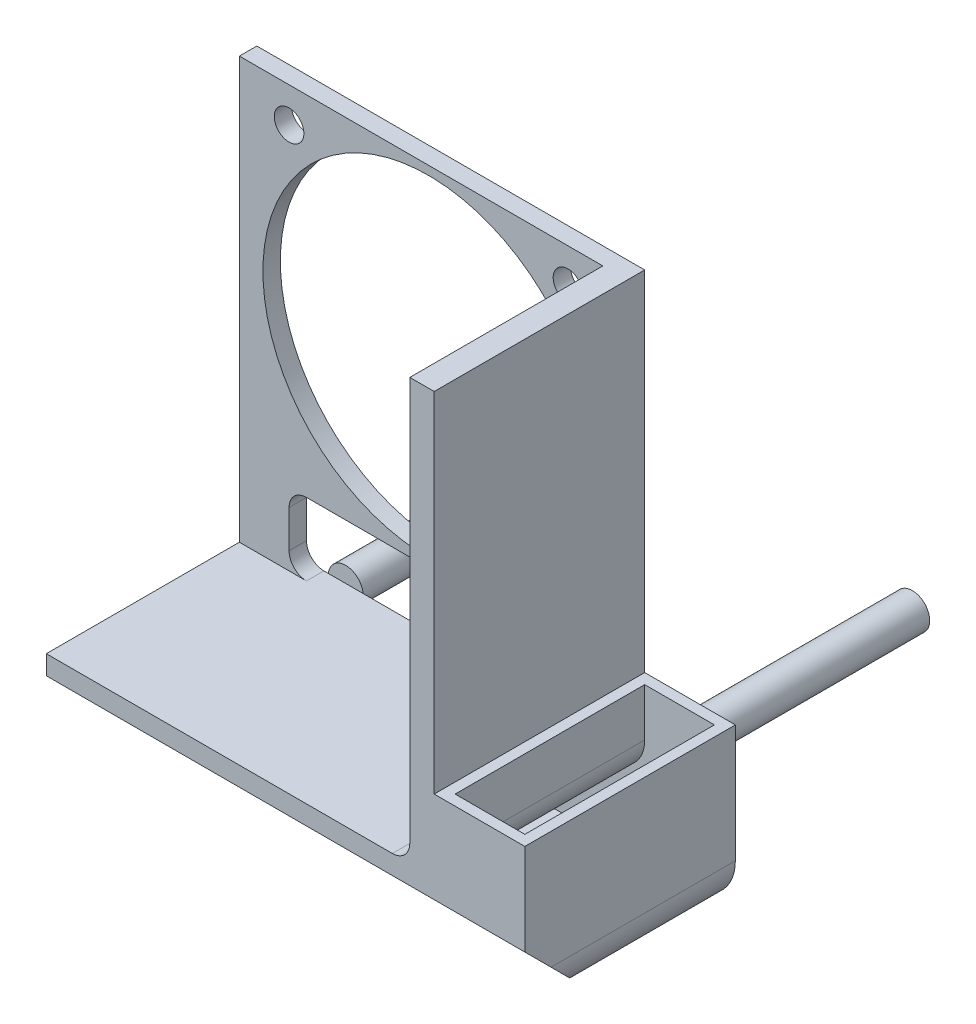
from build123d import *

# Parameters (mm, degrees)
SKETCH1_W              = 40
SKETCH1_H              = 40
BOSS_EXTRUDE1_DEPTH    = 2
M3_CLEARANCE_HOLE1_D   = 3.4
SKETCH10_W             = 40
SKETCH10_H             = 8.3
BOSS_EXTRUDE7_DEPTH    = 2
BOSS_EXTRUDE10_START   = 6
SKETCH20_R             = 2
BOSS_EXTRUDE10_DEPTH   = 30
BOSS_EXTRUDE10_2_DEPTH = 30
BOSS_EXTRUDE11_DEPTH   = 21.75
CHAMFER1_SIZE          = 7.5
FILLET1_R              = 4
SHELL1_T               = 1.2
SKETCH25_W             = 2.8
SKETCH25_H             = 48.3
BOSS_EXTRUDE14_DEPTH   = 24.15
SKETCH26_W             = 36
SKETCH26_H             = 8.3
CUT_EXTRUDE5_DEPTH     = 77.64359073
SKETCH27_R             = 19
CUT_EXTRUDE6_DEPTH     = 77.64359073
FILLET2_R              = 2
FILLET3_R              = 2
SKETCH29_W             = 1.7
SKETCH29_H             = 48.3
BOSS_EXTRUDE15_DEPTH   = 2
DELETEFACE1_OUTLINE_R  = 1.7
DELETEFACE1_DEPTH      = 2


# Read off the part's stored shape, not the designer's step: DeleteFace1
with BuildPart() as part:
    # Sketch1 → Boss-Extrude1 (new body)
    with BuildSketch(Plane.XY):
        with Locations((20, 20)):
            Rectangle(SKETCH1_W, SKETCH1_H)
    extrude(amount=BOSS_EXTRUDE1_DEPTH)

    # M3 Clearance Hole1 (through all)
    with Locations(Plane.XY.offset(2)):
        with Locations((4, 36), (36, 4), (4, 4), (36, 36)):
            Hole(M3_CLEARANCE_HOLE1_D / 2)

    # Sketch10 → Boss-Extrude7 (add)
    with BuildSketch(Plane.XY.offset(2)):
        with Locations((20, -4.15)):
            Rectangle(SKETCH10_W, SKETCH10_H)
    extrude(amount=-BOSS_EXTRUDE7_DEPTH)



with BuildPart() as body_2:
    # Sketch20 → Boss-Extrude10 (new body)
    with BuildSketch(Plane(origin=(0, 0, 0), x_dir=(-1, 0, 0), z_dir=(0, 0, -1)).offset(BOSS_EXTRUDE10_START)):
        with Locations((-37.5, -14.5)):
            Circle(SKETCH20_R)
    extrude(amount=BOSS_EXTRUDE10_DEPTH)


with BuildPart() as body_3:
    # Sketch20 → Boss-Extrude10 2 (new body)
    with BuildSketch(Plane(origin=(0, 0, 0), x_dir=(-1, 0, 0), z_dir=(0, 0, -1)).offset(BOSS_EXTRUDE10_START)):
        with Locations((-2.5, -14.5)):
            Circle(SKETCH20_R)
    extrude(amount=BOSS_EXTRUDE10_2_DEPTH)


with BuildPart() as body_4:
    # Sketch22 → Boss-Extrude11 (new body)
    with BuildSketch(Plane(origin=(0, 0, 22.95), x_dir=(-1, 0, 0), z_dir=(0, 0, -1))):
        Polygon((-44, 0), (-52, 0), (-52, -17.5), (0.5, -17.5), (0.5, -9.5), (-44, -9.5), align=None)
    extrude(amount=BOSS_EXTRUDE11_DEPTH)

    # Chamfer1
    chamfer1_edges = [body_4.edges().sort_by_distance(p)[0] for p in [
        (25.75, -17.5, 22.95),
    ]]
    chamfer(chamfer1_edges, length=CHAMFER1_SIZE)

    # Fillet1
    fillet1_edges = [body_4.edges().sort_by_distance(p)[0] for p in [
        (44, -9.5, 12.075),
        (52, -17.5, 8.325),
    ]]
    fillet(fillet1_edges, radius=FILLET1_R)

    # Shell1
    shell1_openings = [body_4.faces().sort_by_distance(p)[0] for p in [
        (48, 0, 12.075),
    ]]
    offset(amount=SHELL1_T, openings=shell1_openings, kind=Kind.INTERSECTION)


with BuildPart() as part_1:
    add(part.part)

    add(body_4.part)  # Boss-Extrude14 merges body 4
    # Sketch25 → Boss-Extrude14 (add)
    with BuildSketch(Plane(origin=(0, 0, 0), x_dir=(-1, 0, 0), z_dir=(0, 0, -1))):
        with Locations((-41.4, 15.85)):
            Rectangle(SKETCH25_W, SKETCH25_H)
    extrude(amount=-BOSS_EXTRUDE14_DEPTH)

    # Sketch26 → Cut-Extrude5 (cut, through all)
    with BuildSketch(Plane.XY.offset(2)):
        with Locations((22, -4.15)):
            Rectangle(SKETCH26_W, SKETCH26_H)
    extrude(amount=-CUT_EXTRUDE5_DEPTH, mode=Mode.SUBTRACT)

    # Sketch27 → Cut-Extrude6 (cut, through all)
    with BuildSketch(Plane.XY.offset(2)):
        with Locations((20, 20)):
            Circle(SKETCH27_R)
    extrude(amount=-CUT_EXTRUDE6_DEPTH, mode=Mode.SUBTRACT)

    # Fillet2
    fillet2_edges = [part_1.edges().sort_by_distance(p)[0] for p in [
        (4, 0, 1),
        (40, 0, 1),
        (4, -8.3, 1),
    ]]
    fillet(fillet2_edges, radius=FILLET2_R)

    # Fillet3
    fillet3_edges = [part_1.edges().sort_by_distance(p)[0] for p in [
        (40, -8.3, 12.075),
    ]]
    fillet(fillet3_edges, radius=FILLET3_R)

    # Sketch29 → Boss-Extrude15 (add)
    with BuildSketch(Plane.XY.offset(2)):
        with Locations((-0.85, 15.85)):
            Rectangle(SKETCH29_W, SKETCH29_H)
    extrude(amount=-BOSS_EXTRUDE15_DEPTH)

    # DeleteFace1 outline → DeleteFace1 (add)
    with BuildSketch(Plane.XY):
        with Locations((4, 4)):
            Circle(DELETEFACE1_OUTLINE_R)
    extrude(amount=DELETEFACE1_DEPTH)


solid = Compound([body_2.part, body_3.part, part_1.part])
